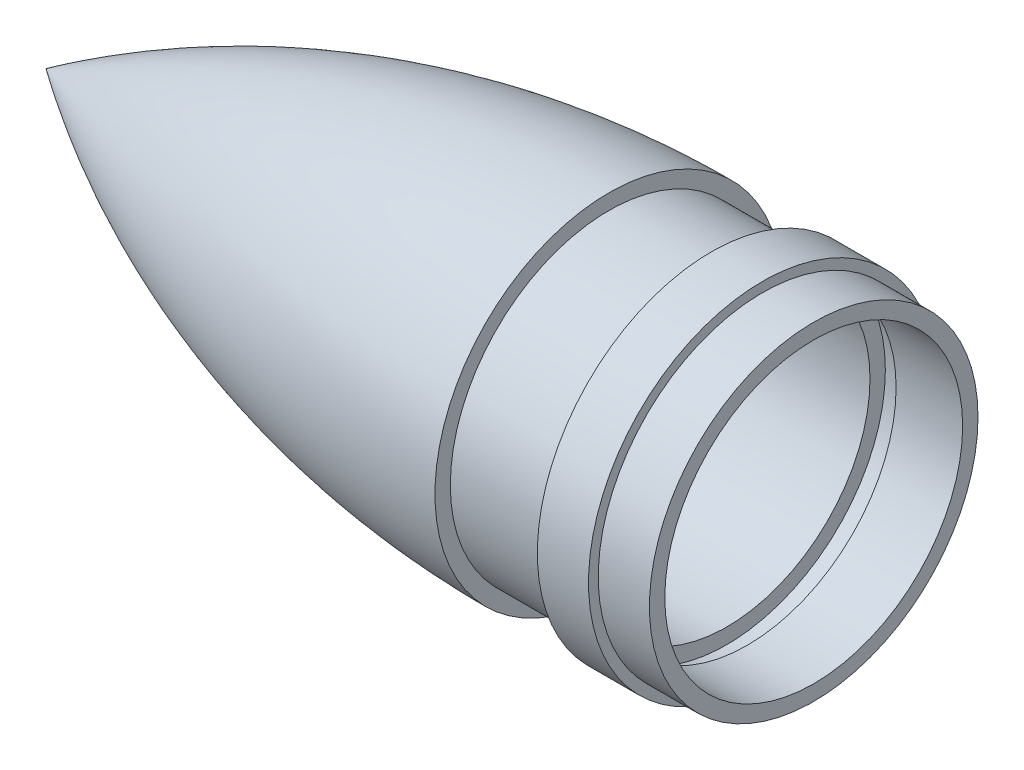
from build123d import *

# Parameters (mm, degrees)
SKETCH3_R           = 31
BOSS_EXTRUDE1_DEPTH = 20
SKETCH4_R           = 34
BOSS_EXTRUDE2_DEPTH = 10
SKETCH5_R           = 32.1
BOSS_EXTRUDE3_DEPTH = 10


# Read off the part's stored shape, not the designer's step: Shell1
with BuildPart() as part:
    # Sketch2 → Revolve1 (revolve)
    with BuildSketch(Plane.XY):
        with BuildLine():
            Line((0, 194.94), (0, 160.94))
            Line((0, 160.94), (-109.999636363, 160.94))
            ThreePointArc((-109.999636363, 160.94), (-57.567178149, 186.246137141), (0, 194.94))
        make_face()
    revolve(axis=Axis((0, 160.94, 0), (-1, 0, 0)))

    # Sketch3 → Boss-Extrude1 (add)
    with BuildSketch(Plane(origin=(0, 0, 0), x_dir=(0, 0, -1), z_dir=(1, 0, 0))):
        with Locations((0, 160.94)):
            Circle(SKETCH3_R)
    extrude(amount=BOSS_EXTRUDE1_DEPTH)

    # Sketch4 → Boss-Extrude2 (add)
    with BuildSketch(Plane(origin=(20, 0, 0), x_dir=(0, 0, -1), z_dir=(1, 0, 0))):
        with Locations((0, 160.94)):
            Circle(SKETCH4_R)
    extrude(amount=BOSS_EXTRUDE2_DEPTH)

    # Sketch5 → Boss-Extrude3 (add)
    with BuildSketch(Plane(origin=(30, 0, 0), x_dir=(0, 0, -1), z_dir=(1, 0, 0))):
        with Locations((0, 160.94)):
            Circle(SKETCH5_R)
    extrude(amount=BOSS_EXTRUDE3_DEPTH)

    # Shell1 outline → Shell1 (revolve, cut)
    with BuildSketch(Plane(origin=(0, 160.94, 0), x_dir=(0, 1, 0), z_dir=(0, 0, -1))):
        with BuildLine():
            add(Edge.make_bspline(
                [(0, -104.591012998), (8.229468148, -91.927873349), (15.330015701, -78.27560373), (21.066492113, -63.844676124), (25.296938568, -48.911589478), (28.245120771, -32.432867767), (28.477690329, -31.061294527), (28.697695325, -29.688467979), (28.905130797, -28.31461708), (29.778715266, -22.152175527), (30.304993555, -17.354712639), (30.678965492, -12.557283311), (30.902000375, -7.769341741), (30.976553741, -3)],
                knots=[5.706897395, 5.706897395, 5.706897395, 5.706897395, 5.706897395, 5.706897395, 6.105509507, 6.105509507, 6.105509507, 6.105509507, 6.141656709, 6.141656709, 6.141656709, 6.141656709, 6.267554786, 6.267554786, 6.267554786, 6.267554786, 6.267554786, 6.267554786], degree=5, weights=[1, 1, 0.99984737, 0.999842267, 1, 1, 0.99999999, 0.99999999, 1, 1, 0.999998627, 0.999998669, 1, 1]))
            Line((30.976553741, -3), (28, -3))
            Line((28, -3), (28, 23))
            Line((28, 23), (31, 23))
            Line((31, 23), (31, 27))
            Line((31, 27), (29.1, 27))
            Line((29.1, 27), (29.1, 40))
            Line((29.1, 40), (0, 40))
            Line((0, 40), (0, -104.591012998))
        make_face()
    revolve(axis=Axis((0, 160.94, 0), (1, 0, 0)), mode=Mode.SUBTRACT)


solid = part.part
